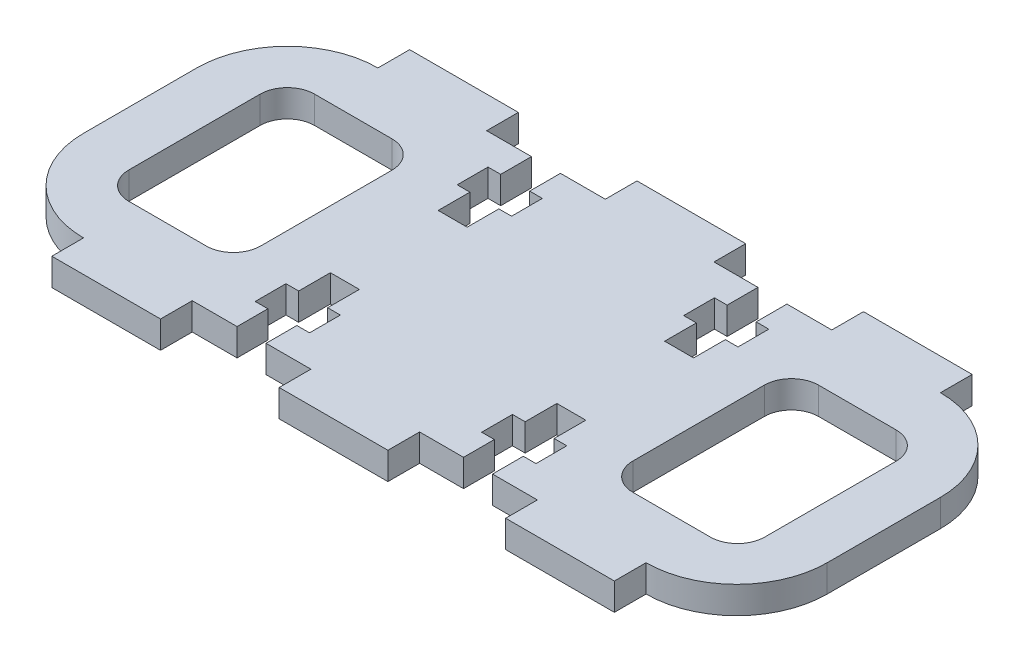
from build123d import *

# Parameters (mm, degrees)
EXTRUDE_1_DEPTH     = 3
FILLET_1_R          = 10
SKETCH_2_W          = 14.55
SKETCH_2_H          = 20.5
CUT_EXTRUDE_1_DEPTH = 90.696209507
FILLET_2_R          = 3


with BuildPart() as part:
    # 草图1 → 凸台-拉伸1 (new body)
    with BuildSketch(Plane(origin=(0, 0, 0), x_dir=(1, 0, 0), z_dir=(0, 1, 0))):
        Polygon((10, 0), (10, -3.5), (22, -3.5), (22, 0), (26.95, 0), (26.95, 3.4), (25.55, 3.4), (25.55, 6.8), (26.95, 6.8), (26.95, 10.3), (30.15, 10.3), (30.15, 6.8), (31.55, 6.8), (31.55, 3.4), (30.15, 3.4), (30.15, 0), (35.1, 0), (35.1, -3.5), (47.1, -3.5), (47.1, 0), (51.95, 0), (51.95, 3.4), (50.55, 3.4), (50.55, 6.8), (51.95, 6.8), (51.95, 10.3), (55.15, 10.3), (55.15, 6.8), (56.55, 6.8), (56.55, 3.4), (55.15, 3.4), (55.15, 0), (60.1, 0), (60.1, -3.5), (72.1, -3.5), (72.1, 0), (82.1, 0), (82.1, 32.5), (72.1, 32.5), (72.1, 36), (60.1, 36), (60.1, 32.5), (55.15, 32.5), (55.15, 29.1), (56.55, 29.1), (56.55, 25.7), (55.15, 25.7), (55.15, 22.2), (51.95, 22.2), (51.95, 25.7), (50.55, 25.7), (50.55, 29.1), (51.95, 29.1), (51.95, 32.5), (47.1, 32.5), (47.1, 36), (35.1, 36), (35.1, 32.5), (30.15, 32.5), (30.15, 29.1), (31.55, 29.1), (31.55, 25.7), (30.15, 25.7), (30.15, 22.2), (26.95, 22.2), (26.95, 25.7), (25.55, 25.7), (25.55, 29.1), (26.95, 29.1), (26.95, 32.5), (22, 32.5), (22, 36), (10, 36), (10, 32.5), (0, 32.5), (0, 0), align=None)
    extrude(amount=EXTRUDE_1_DEPTH)

    # 圆角1
    fillet_1_edges = [part.edges().sort_by_distance(p)[0] for p in [
        (0, 1.5, -32.5),
        (82.1, 1.5, -32.5),
        (82.1, 1.5, 0),
        (0, 1.5, 0),
    ]]
    fillet(fillet_1_edges, radius=FILLET_1_R - 0.0001)  # a hair under: the kernel refuses the full size

    # 草图2 → 切除-拉伸1 (cut, through all)
    with BuildSketch(Plane.XZ):
        with Locations((13.275, -16.25)):
            Rectangle(SKETCH_2_W, SKETCH_2_H)
        with Locations((68.925, -16.25)):
            Rectangle(SKETCH_2_W, SKETCH_2_H)
    extrude(amount=-CUT_EXTRUDE_1_DEPTH, mode=Mode.SUBTRACT)

    # 圆角2
    fillet_2_edges = [part.edges().sort_by_distance(p)[0] for p in [
        (6, 1.5, -26.5),
        (6, 1.5, -6),
        (20.55, 1.5, -6),
        (20.55, 1.5, -26.5),
        (61.65, 1.5, -6),
        (76.2, 1.5, -6),
        (76.2, 1.5, -26.5),
        (61.65, 1.5, -26.5),
    ]]
    fillet(fillet_2_edges, radius=FILLET_2_R)


solid = part.part
